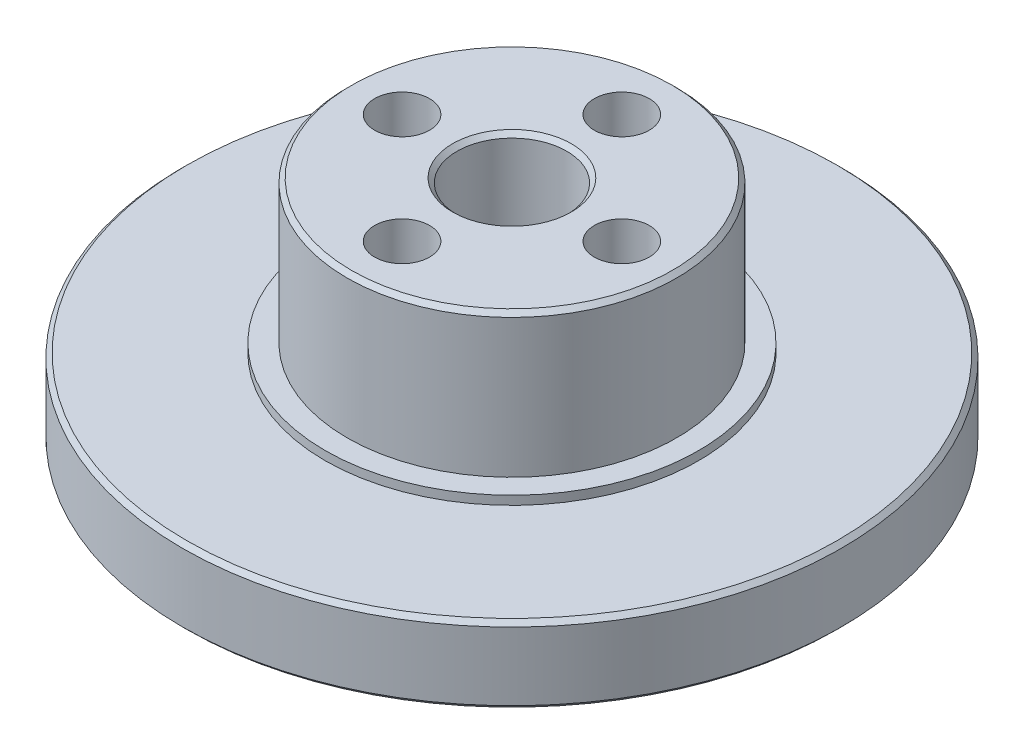
from build123d import *

# Parameters (mm, degrees)
SKETCH_1_R          = 15
SKETCH_1_R_2        = 1.83
EXTRUDE_1_DEPTH     = 2
SKETCH_2_R          = 15
EXTRUDE_2_DEPTH     = 1.5
SKETCH_3_R          = 8.5
EXTRUDE_3_DEPTH     = 0.4
SKETCH_4_R          = 7.5
EXTRUDE_4_DEPTH     = 6.5
SKETCH_5_R          = 1.25
SKETCH_5_R_2        = 2.5
CUT_EXTRUDE_1_DEPTH = 5
CHAMFER_1_SIZE      = 0.2
SKETCH_7_R          = 2.5
CUT_EXTRUDE_4_DEPTH = 22.889723616
SKETCH_8_R          = 6
CUT_EXTRUDE_5_DEPTH = 2
CHAMFER_2_SIZE      = 0.5


with BuildPart() as part:
    # 草图1 → 凸台-拉伸1 (new body)
    with BuildSketch(Plane(origin=(0, 0, 0), x_dir=(1, 0, 0), z_dir=(0, 1, 0))):
        Circle(SKETCH_1_R)
        with Locations((0, 11.525)):
            Circle(SKETCH_1_R_2, mode=Mode.SUBTRACT)
        with Locations((9.980942779, 5.7625)):
            Circle(SKETCH_1_R_2, mode=Mode.SUBTRACT)
        with Locations((9.980942779, -5.7625)):
            Circle(SKETCH_1_R_2, mode=Mode.SUBTRACT)
        with Locations((0, -11.525)):
            Circle(SKETCH_1_R_2, mode=Mode.SUBTRACT)
        with Locations((-9.980942779, -5.7625)):
            Circle(SKETCH_1_R_2, mode=Mode.SUBTRACT)
        with Locations((-9.980942779, 5.7625)):
            Circle(SKETCH_1_R_2, mode=Mode.SUBTRACT)
    extrude(amount=EXTRUDE_1_DEPTH)

    # 草图2 → 凸台-拉伸2 (add)
    with BuildSketch(Plane(origin=(0, 2, 0), x_dir=(1, 0, 0), z_dir=(0, 1, 0))):
        Circle(SKETCH_2_R)
    extrude(amount=EXTRUDE_2_DEPTH)

    # 草图3 → 凸台-拉伸3 (add)
    with BuildSketch(Plane(origin=(0, 3.5, 0), x_dir=(1, 0, 0), z_dir=(0, 1, 0))):
        Circle(SKETCH_3_R)
    extrude(amount=EXTRUDE_3_DEPTH)

    # 草图4 → 凸台-拉伸4 (add)
    with BuildSketch(Plane(origin=(0, 3.9, 0), x_dir=(1, 0, 0), z_dir=(0, 1, 0))):
        Circle(SKETCH_4_R)
    extrude(amount=EXTRUDE_4_DEPTH)

    # 草图5 → 切除-拉伸1 (cut)
    with BuildSketch(Plane(origin=(0, 10.4, 0), x_dir=(1, 0, 0), z_dir=(0, 1, 0))):
        with Locations((0, 5)):
            Circle(SKETCH_5_R)
        with Locations((5, 0)):
            Circle(SKETCH_5_R)
        with Locations((0, -5)):
            Circle(SKETCH_5_R)
        with Locations((-5, 0)):
            Circle(SKETCH_5_R)
        Circle(SKETCH_5_R_2)
    extrude(amount=-CUT_EXTRUDE_1_DEPTH, mode=Mode.SUBTRACT)

    # 倒角1
    chamfer_1_edges = [part.edges().sort_by_distance(p)[0] for p in [
        (-11.810942779, 0, -5.7625),
        (-11.810942779, 0, 5.7625),
        (-1.83, 0, 11.525),
        (8.150942779, 0, 5.7625),
        (8.150942779, 0, -5.7625),
        (-1.83, 0, -11.525),
        (-15, 0, 0),
        (-7.5, 10.4, 0),
        (-15, 3.5, 0),
        (-2.5, 10.4, 0),
    ]]
    chamfer(chamfer_1_edges, length=CHAMFER_1_SIZE)

    # 草图7 → 切除-拉伸4 (cut, through all)
    with BuildSketch(Plane(origin=(0, 5.4, 0), x_dir=(1, 0, 0), z_dir=(0, 1, 0))):
        Circle(SKETCH_7_R)
    extrude(amount=-CUT_EXTRUDE_4_DEPTH, mode=Mode.SUBTRACT)

    # 草图8 → 切除-拉伸5 (cut)
    with BuildSketch(Plane(origin=(0, 0, 0), x_dir=(-1, 0, 0), z_dir=(0, -1, 0))):
        Circle(SKETCH_8_R)
    extrude(amount=-CUT_EXTRUDE_5_DEPTH, mode=Mode.SUBTRACT)

    # 倒角2
    chamfer_2_edges = [part.edges().sort_by_distance(p)[0] for p in [
        (6, 0, 0),
        (-2.5, 2, 0),
        (6, 2, 0),
    ]]
    chamfer(chamfer_2_edges, length=CHAMFER_2_SIZE)


solid = part.part
